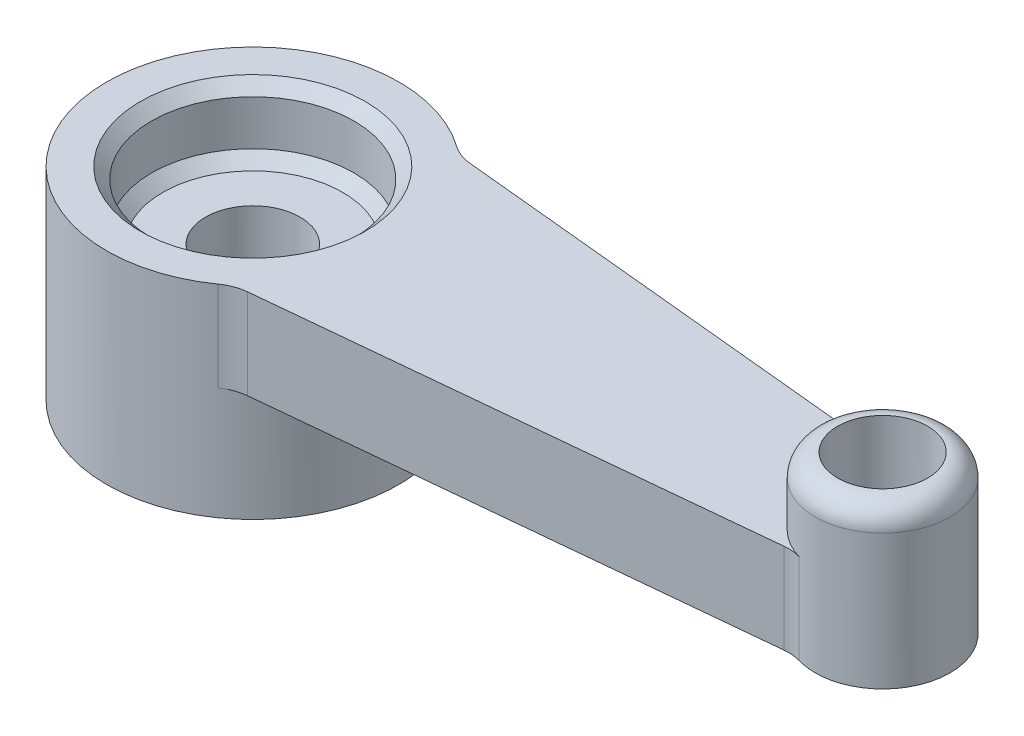
from build123d import *
from build123d.topology import SkipClean

# Parameters (mm, degrees)
BOSS_EXTRUDE1_DEPTH       = 1
SKETCH2_R                 = 3.25
BOSS_EXTRUDE2_DEPTH       = 4.5
BOSS_EXTRUDE3_START       = -3.5
SKETCH3_R                 = 1.5
BOSS_EXTRUDE3_DEPTH       = 3.5
F_2_0MM_DOWEL_HOLE2_D     = 2
F_2_0MM_DOWEL_HOLE2_DEPTH = 2.399139
F_2_0MM_DOWEL_HOLE2_TIP   = 0.600861
FILLET1_R                 = 0.5
CUT_EXTRUDE1_DEPTH        = 17.463976
CUT_EXTRUDE1_DEPTH_BACK   = 1.5
SKETCH10_R                = 2.25
CUT_EXTRUDE2_DEPTH        = 1.5
CHAMFER1_SIZE             = 0.25
F_2_0MM_DOWEL_HOLE1_D     = 2.1


with BuildPart() as part:
    # Sketch1 → Boss-Extrude1 (new, symmetric)
    with BuildSketch(Plane(origin=(0, 0, 0), x_dir=(1, 0, 0), z_dir=(0, 1, 0))):
        with BuildLine():
            Line((2.359924, 2.472234), (13.214543, 1.408264))
            ThreePointArc((13.214543, 1.408264), (13.402497, 1.407589), (13.587257, 1.442097))
            ThreePointArc((13.587257, 1.442097), (15.5, 0), (13.587257, -1.442097))
            ThreePointArc((13.587257, -1.442097), (13.402497, -1.407589), (13.214543, -1.408264))
            Line((13.214543, -1.408264), (2.359924, -2.472234))
            ThreePointArc((2.359924, -2.472234), (2.107887, -2.530561), (1.879247, -2.65159))
            ThreePointArc((1.879247, -2.65159), (-3.25, 0), (1.879247, 2.65159))
            ThreePointArc((1.879247, 2.65159), (2.107887, 2.530561), (2.359924, 2.472234))
        make_face()
    extrude(amount=BOSS_EXTRUDE1_DEPTH, both=True)

    # Sketch2 → Boss-Extrude2 (add)
    with SkipClean():  # the faces are left unmerged after this step: merging them gives an invalid solid
        with BuildSketch(Plane(origin=(0, 1, 0), x_dir=(1, 0, 0), z_dir=(0, 1, 0))):
            with Locations(Location((0, 0, 0), (0, 0, 54.673872))):
                Circle(SKETCH2_R)
        extrude(amount=-BOSS_EXTRUDE2_DEPTH)

    # Sketch3 → Boss-Extrude3 (add)
    with SkipClean():  # the faces are left unmerged after this step: merging them gives an invalid solid
        with BuildSketch(Plane.XZ.offset(1).offset(BOSS_EXTRUDE3_START)):
            with Locations(Location((14, 0, 0), (0, 0, 270))):
                Circle(SKETCH3_R)
        extrude(amount=BOSS_EXTRUDE3_DEPTH)

    # Ø2.0mm Dowel Hole2
    with Locations(Plane(origin=(0, 2.5, 0), x_dir=(1, 0, 0), z_dir=(0, 1, 0))):
        with Locations((14, 0)):
            Hole(F_2_0MM_DOWEL_HOLE2_D / 2, depth=F_2_0MM_DOWEL_HOLE2_DEPTH)
            with Locations((0, 0, -(F_2_0MM_DOWEL_HOLE2_DEPTH + F_2_0MM_DOWEL_HOLE2_TIP / 2))):  # 118° drill point
                Cone(0, F_2_0MM_DOWEL_HOLE2_D / 2, F_2_0MM_DOWEL_HOLE2_TIP, mode=Mode.SUBTRACT)

    # Fillet1
    fillet1_edges = [part.edges().sort_by_distance(p)[0] for p in [
        (14, 2.5, 1.5),
    ]]
    fillet(fillet1_edges, radius=FILLET1_R - 0.0001)  # a hair under: the kernel refuses the full size

    # Sketch10 → Cut-Extrude1 (cut, two sides: drawn at the far end of the back side and taken through both)
    with BuildSketch(Plane(origin=(0, 1, 0), x_dir=(1, 0, 0), z_dir=(0, 1, 0)).offset(-CUT_EXTRUDE1_DEPTH_BACK)):
        with Locations(Location((0, 0, 0), (0, 0, 90))):
            Circle(SKETCH10_R)
    extrude(amount=CUT_EXTRUDE1_DEPTH + CUT_EXTRUDE1_DEPTH_BACK, mode=Mode.SUBTRACT)

    # Sketch12 → Cut-Extrude2 (cut)
    with BuildSketch(Plane.XZ.offset(3.5)):
        with BuildLine():
            Line((1.732051, 1), (1.732051, -1))
            ThreePointArc((1.732051, -1), (-2, 0), (1.732051, 1))
        make_face()
    extrude(amount=-CUT_EXTRUDE2_DEPTH, mode=Mode.SUBTRACT)

    # Chamfer1
    chamfer1_edges = [part.edges().sort_by_distance(p)[0] for p in [
        (0, -0.5, 2.25),
        (0, 1, 2.25),
    ]]
    chamfer(chamfer1_edges, length=CHAMFER1_SIZE)

    # Ø2.0mm Dowel Hole1 (through all)
    with Locations(Plane(origin=(0, -0.5, 0), x_dir=(1, 0, 0), z_dir=(0, 1, 0))):
        with Locations((0, 0)):
            Hole(F_2_0MM_DOWEL_HOLE1_D / 2)


solid = part.part
